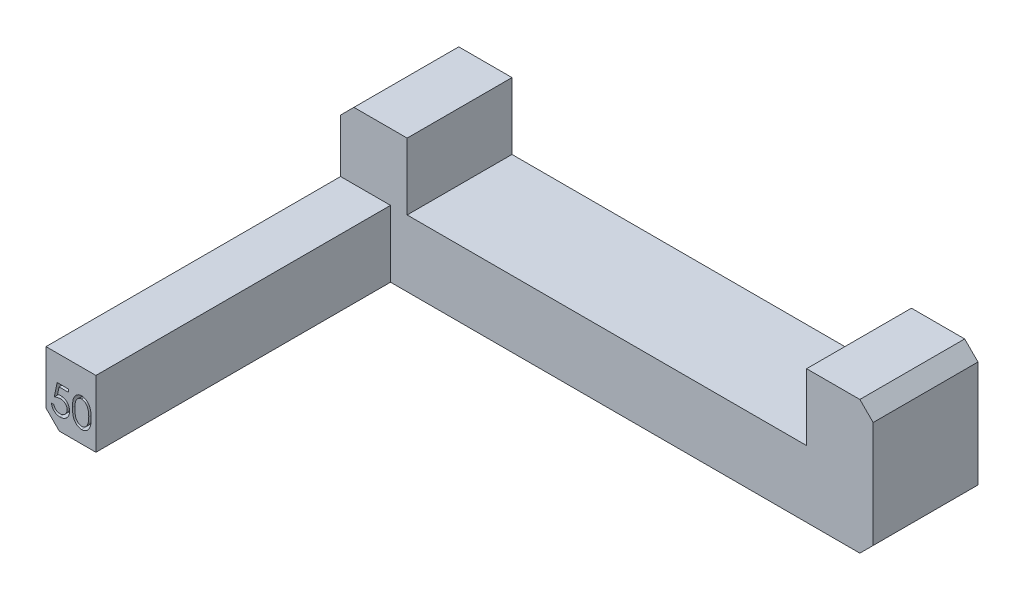
from build123d import *

# Parameters (mm, degrees)
BOSS_EXTRUDE1_DEPTH = 20
SKETCH2_W           = 9.525
SKETCH2_H           = 12.7
BOSS_EXTRUDE2_DEPTH = 56.2
CUT_EXTRUDE1_DEPTH  = 2
CHAMFER1_SIZE       = 2.54


with BuildPart() as part:
    # Sketch1 → Boss-Extrude1 (new body)
    with BuildSketch(Plane.XY):
        Polygon((-101.6, 0), (0, 0), (0, 25.4), (-12.7, 25.4), (-12.7, 12.7), (-88.9, 12.7), (-88.9, 25.4), (-101.6, 25.4), align=None)
    extrude(amount=BOSS_EXTRUDE1_DEPTH)

    # Sketch2 → Boss-Extrude2 (add)
    with BuildSketch(Plane.XY.offset(20)):
        with Locations((-96.8375, 6.35)):
            Rectangle(SKETCH2_W, SKETCH2_H)
    extrude(amount=BOSS_EXTRUDE2_DEPTH)

    # Sketch3 → Cut-Extrude1 (cut)
    # profile 1 of 2: a face of its own
    with BuildSketch(Plane.XY.offset(76.2)):
        with BuildLine():
            Line((-97.310222222, 7.831666667), (-97.310222222, 7.288931624))
            Line((-97.310222222, 7.288931624), (-99.11015211, 7.288931624))
            Line((-99.11015211, 7.288931624), (-99.395300013, 5.897113048))
            add(Edge.make_bspline(
                [(-99.395300013, 5.897113048), (-99.33927506, 5.912580244), (-99.230735575, 5.942545491), (-99.070534357, 5.975816121), (-98.918448525, 5.995872209), (-98.819758382, 5.998610738), (-98.772002738, 5.999935897)],
                knots=[0, 0, 0, 0, 1.100273476, 2.13160584, 3.095893838, 4, 4, 4, 4], degree=3))
            add(Edge.make_bspline(
                [(-98.772002738, 5.999935897), (-98.712911846, 5.998656923), (-98.596724388, 5.99614214), (-98.426727408, 5.971994225), (-98.264450296, 5.933985069), (-98.110232427, 5.880886184), (-97.963788499, 5.812986945), (-97.826465876, 5.728169178), (-97.696203317, 5.629089023), (-97.575337729, 5.51517454), (-97.465687882, 5.389804953), (-97.369279779, 5.255006743), (-97.2873911, 5.112089921), (-97.221531388, 4.959689), (-97.168940787, 4.799488852), (-97.133937176, 4.629803876), (-97.11062858, 4.452233504), (-97.108024496, 4.330820642), (-97.106696581, 4.268907919)],
                knots=[0, 0, 0, 0, 1.052922333, 2.070308379, 3.05430497, 4.020497103, 4.973039431, 5.925935799, 6.892292201, 7.88610001, 8.88166317, 9.857072816, 10.836096531, 11.812156883, 12.81219415, 13.836441305, 14.89672472, 16, 16, 16, 16], degree=3))
            add(Edge.make_bspline(
                [(-97.106696581, 4.268907919), (-97.107702112, 4.225785039), (-97.109699584, 4.140122045), (-97.119857448, 4.012904028), (-97.139415019, 3.888379268), (-97.165673364, 3.766531247), (-97.199755353, 3.647590649), (-97.241013804, 3.531217029), (-97.291505417, 3.418134707), (-97.346888567, 3.307273693), (-97.409249314, 3.201140236), (-97.478462057, 3.101885221), (-97.551586073, 3.0080197), (-97.630267692, 2.920550365), (-97.715238244, 2.840051993), (-97.80546867, 2.766046853), (-97.900238972, 2.697283413), (-98.00101535, 2.636552928), (-98.105552199, 2.580668458), (-98.215359146, 2.534822158), (-98.327936634, 2.493833621), (-98.444904958, 2.461162074), (-98.565999175, 2.435561664), (-98.691418895, 2.418173851), (-98.820506336, 2.405509475), (-98.908007843, 2.404716697), (-98.952207732, 2.404316239)],
                knots=[0, 0, 0, 0, 1.056347294, 2.098418968, 3.122841568, 4.141288669, 5.149314143, 6.15115421, 7.162517403, 8.180376062, 9.185164535, 10.17417709, 11.141909838, 12.097768115, 13.052685741, 14.0056014, 14.954263652, 15.917497458, 16.885230207, 17.854509472, 18.828990115, 19.81800267, 20.826176721, 21.857883937, 22.917946725, 24, 24, 24, 24], degree=3))
            add(Edge.make_bspline(
                [(-98.952207732, 2.404316239), (-99.004934172, 2.405360721), (-99.108667214, 2.407415614), (-99.260644738, 2.42891261), (-99.406868011, 2.459700912), (-99.546159949, 2.506020034), (-99.679768884, 2.564057968), (-99.805896088, 2.637409798), (-99.927764345, 2.720532967), (-100.040419448, 2.818625882), (-100.144976905, 2.925843639), (-100.238573651, 3.042196263), (-100.321930368, 3.165763396), (-100.3937122, 3.297145129), (-100.454941351, 3.435996241), (-100.503042583, 3.582836969), (-100.54186581, 3.73690007), (-100.558290268, 3.842965496), (-100.566632479, 3.896837607)],
                knots=[0, 0, 0, 0, 1.0467383, 2.05933395, 3.04377827, 4.011590433, 4.970194871, 5.932262533, 6.905835911, 7.896367577, 8.894135286, 9.877477877, 10.858688626, 11.851381753, 12.8477658, 13.868841284, 14.917554742, 16, 16, 16, 16], degree=3))
            Line((-100.566632479, 3.896837607), (-100.091739316, 3.896837607))
            add(Edge.make_bspline(
                [(-100.091739316, 3.896837607), (-100.080054474, 3.846375589), (-100.057595557, 3.74938479), (-100.00829877, 3.613114786), (-99.948025363, 3.491679769), (-99.876354503, 3.383473375), (-99.790856243, 3.289116915), (-99.693293892, 3.205029214), (-99.583911025, 3.129169197), (-99.462364118, 3.065937157), (-99.33413482, 3.012009398), (-99.199927252, 2.976099098), (-99.063395681, 2.950848938), (-98.971051002, 2.948321395), (-98.924646968, 2.947051282)],
                knots=[0, 0, 0, 0, 1.136247022, 2.183929868, 3.172523383, 4.106158343, 5.02341133, 5.958108904, 6.928429099, 7.938127109, 8.96079061, 9.975095812, 10.982467395, 12, 12, 12, 12], degree=3))
            add(Edge.make_bspline(
                [(-98.924646968, 2.947051282), (-98.879352654, 2.94829222), (-98.790167777, 2.950735637), (-98.658917228, 2.969542239), (-98.532200145, 2.998506662), (-98.411266879, 3.041852752), (-98.294001218, 3.094534648), (-98.183369446, 3.162139584), (-98.076171049, 3.239942231), (-97.975738037, 3.329079041), (-97.883754584, 3.427307031), (-97.802480449, 3.532350233), (-97.73478202, 3.644407847), (-97.677731641, 3.761539875), (-97.634410582, 3.885030075), (-97.603505765, 4.014299709), (-97.585358284, 4.149668072), (-97.582861857, 4.241999052), (-97.581589744, 4.289048478)],
                knots=[0, 0, 0, 0, 1.027316725, 2.022795036, 3.002884548, 3.971462791, 4.93288096, 5.914575861, 6.907176829, 7.935150275, 8.956128384, 9.956726525, 10.942570165, 11.921478529, 12.907843606, 13.90538589, 14.932640048, 16, 16, 16, 16], degree=3))
            add(Edge.make_bspline(
                [(-97.581589744, 4.289048478), (-97.582585302, 4.33149634), (-97.584533965, 4.414581991), (-97.600455185, 4.536137935), (-97.628148703, 4.651153129), (-97.666587188, 4.760182983), (-97.715390729, 4.863330331), (-97.775029797, 4.960701624), (-97.846623624, 5.051013491), (-97.928405408, 5.134308185), (-98.017997923, 5.211180793), (-98.116942629, 5.276712924), (-98.223168947, 5.331842895), (-98.335397032, 5.379419511), (-98.456296342, 5.413589686), (-98.58347268, 5.439243513), (-98.718299369, 5.454083406), (-98.810481243, 5.456142452), (-98.857865118, 5.457200855)],
                knots=[0, 0, 0, 0, 1.045622112, 2.046656509, 3.013763289, 3.955457236, 4.890082067, 5.820317437, 6.762574623, 7.722996705, 8.69280354, 9.665887285, 10.63943826, 11.638615906, 12.663482002, 13.728887084, 14.832589034, 16, 16, 16, 16], degree=3))
            add(Edge.make_bspline(
                [(-98.857865118, 5.457200855), (-98.898881474, 5.456323056), (-98.983569845, 5.454510625), (-99.113476976, 5.441165802), (-99.249989462, 5.419637345), (-99.392583996, 5.390024804), (-99.541688812, 5.351273057), (-99.696989252, 5.304835658), (-99.858811845, 5.249315493), (-99.967846976, 5.207387027), (-100.023897436, 5.185833333)],
                knots=[0, 0, 0, 0, 0.817624296, 1.688186739, 2.600797293, 3.572016777, 4.590301741, 5.671205678, 6.80286297, 8, 8, 8, 8], degree=3))
            Line((-100.023897436, 5.185833333), (-99.481162393, 7.831666667))
            Line((-99.481162393, 7.831666667), (-97.310222222, 7.831666667))
        make_face()
    # profile 2 of 2: a face of its own
    with BuildSketch(Plane.XY.offset(76.2)):
        with BuildLine():
            add(Edge.make_bspline(
                [(-96.563961538, 5.183713275), (-96.563465606, 5.268527182), (-96.562502251, 5.43327942), (-96.551785233, 5.673346677), (-96.533982037, 5.898560447), (-96.509583866, 6.108931511), (-96.479893111, 6.304514179), (-96.440257792, 6.484785776), (-96.395183673, 6.650580657), (-96.342943666, 6.802439469), (-96.283997842, 6.942408139), (-96.219841281, 7.073074812), (-96.147927842, 7.194241781), (-96.072367509, 7.307842965), (-95.990101639, 7.412018789), (-95.903471325, 7.508240433), (-95.809095393, 7.594284068), (-95.710182035, 7.672670739), (-95.605835714, 7.741386012), (-95.499030731, 7.8019117), (-95.38903194, 7.853618642), (-95.27553902, 7.89427442), (-95.159572058, 7.927855105), (-95.040725659, 7.950819348), (-94.918803597, 7.965268483), (-94.836508452, 7.966649862), (-94.794772503, 7.967350427)],
                knots=[0, 0, 0, 0, 1.646270934, 3.197905019, 4.663502075, 6.030701355, 7.308322542, 8.50163776, 9.611534131, 10.641858119, 11.616356847, 12.558055219, 13.465016945, 14.349605745, 15.204443733, 16.039544428, 16.859896111, 17.680448484, 18.487036065, 19.28249412, 20.06191084, 20.843045899, 21.620316918, 22.403196591, 23.190181807, 24, 24, 24, 24], degree=3))
            add(Edge.make_bspline(
                [(-94.794772503, 7.967350427), (-94.75268791, 7.966612897), (-94.668994897, 7.965146182), (-94.545260044, 7.951049269), (-94.424383739, 7.927658404), (-94.306881315, 7.894515978), (-94.191787586, 7.853398705), (-94.080002779, 7.801862231), (-93.970832548, 7.741871562), (-93.866011756, 7.6713807), (-93.764389659, 7.592788449), (-93.668462382, 7.50394489), (-93.578221193, 7.4057471), (-93.492533529, 7.299245711), (-93.413830423, 7.182398023), (-93.338880115, 7.057236333), (-93.271793823, 6.921571812), (-93.207183064, 6.777668009), (-93.151413453, 6.621543192), (-93.101118058, 6.454077423), (-93.060479618, 6.27329264), (-93.02662917, 6.080137365), (-93.000405339, 5.873902241), (-92.981305988, 5.655029359), (-92.971216919, 5.423374721), (-92.969316906, 5.26499083), (-92.96834188, 5.183713275)],
                knots=[0, 0, 0, 0, 0.810914788, 1.612654377, 2.396697861, 3.181598691, 3.963628158, 4.749916497, 5.551656086, 6.361998678, 7.18212741, 8.025565596, 8.878627764, 9.750805457, 10.657531673, 11.591944965, 12.560506719, 13.57287815, 14.630710178, 15.753379473, 16.941251878, 18.199788006, 19.531962791, 20.947069417, 22.433333509, 24, 24, 24, 24], degree=3))
            add(Edge.make_bspline(
                [(-92.96834188, 5.183713275), (-92.969327014, 5.102790223), (-92.971246507, 4.945114958), (-92.981192885, 4.71450265), (-93.000785101, 4.496791323), (-93.02529306, 4.291458838), (-93.059236778, 4.099359819), (-93.10097316, 3.919829522), (-93.147313529, 3.752092651), (-93.204516134, 3.597523353), (-93.267125185, 3.453965391), (-93.33524435, 3.319909107), (-93.40822373, 3.194169593), (-93.487732904, 3.077753309), (-93.572480326, 2.969835578), (-93.664279841, 2.872321315), (-93.760543701, 2.782860894), (-93.862464854, 2.703256648), (-93.968920413, 2.633580812), (-94.077715684, 2.571269396), (-94.190781038, 2.521024726), (-94.305554193, 2.477882461), (-94.423676841, 2.444922254), (-94.545001742, 2.42213202), (-94.668911765, 2.406148392), (-94.752673655, 2.404929072), (-94.794772503, 2.404316239)],
                knots=[0, 0, 0, 0, 1.561518951, 3.042555995, 4.452378317, 5.7783523, 7.031515105, 8.214008947, 9.334062868, 10.386615937, 11.391082383, 12.354592575, 13.286541444, 14.194233754, 15.072674879, 15.931287219, 16.775624067, 17.606195743, 18.42308326, 19.229000347, 20.022332153, 20.807536673, 21.593273796, 22.3848459, 23.188221202, 24, 24, 24, 24], degree=3))
            add(Edge.make_bspline(
                [(-94.794772503, 2.404316239), (-94.836507294, 2.405021324), (-94.918800156, 2.406411614), (-95.040738943, 2.42079547), (-95.159094542, 2.443920815), (-95.274450991, 2.47630068), (-95.387400127, 2.515935016), (-95.496402846, 2.567572133), (-95.60267113, 2.627041499), (-95.705921459, 2.69476791), (-95.804213654, 2.772361407), (-95.898100832, 2.858183606), (-95.985224372, 2.954376144), (-96.066314017, 3.059420147), (-96.143381984, 3.172349216), (-96.21427425, 3.294705208), (-96.279846851, 3.426002965), (-96.339784033, 3.567090758), (-96.392925465, 3.720027375), (-96.439866643, 3.886562443), (-96.476929714, 4.068165845), (-96.508653944, 4.263379007), (-96.534242, 4.473040783), (-96.551711039, 4.697264995), (-96.562508027, 4.935911918), (-96.563468193, 5.099605505), (-96.563961538, 5.183713275)],
                knots=[0, 0, 0, 0, 0.810891512, 1.598919785, 2.382837074, 3.152667961, 3.926044502, 4.706494248, 5.493654104, 6.291793342, 7.103789334, 7.925228297, 8.761435821, 9.622817696, 10.50288917, 11.416980706, 12.369136599, 13.353924996, 14.394355917, 15.514179734, 16.714354668, 17.994756427, 19.357759367, 20.818452758, 22.365282078, 24, 24, 24, 24], degree=3))
        make_face()
        with BuildLine():
            add(Edge.make_bspline(
                [(-96.089068376, 5.185833333), (-96.088887783, 5.115153753), (-96.088537289, 4.977978566), (-96.07938089, 4.778644112), (-96.066907325, 4.592724686), (-96.050818697, 4.419984221), (-96.026926144, 4.261007416), (-96.000155167, 4.114700871), (-95.967576508, 3.981838858), (-95.929030469, 3.861509668), (-95.88512612, 3.751671195), (-95.837189874, 3.649464596), (-95.785693305, 3.553682502), (-95.72806078, 3.465185261), (-95.665293958, 3.383684275), (-95.598810578, 3.307737016), (-95.526129409, 3.240008247), (-95.425582084, 3.158778359), (-95.292842176, 3.074838716), (-95.125594583, 3.001744033), (-94.953738711, 2.955808652), (-94.837093368, 2.949967021), (-94.778872062, 2.947051282)],
                knots=[0, 0, 0, 0, 1.459021318, 2.831673884, 4.118529203, 5.306027144, 6.411944654, 7.436330062, 8.375795394, 9.233974572, 10.042671642, 10.816086306, 11.563610507, 12.285937304, 12.993564865, 13.685989202, 14.367179055, 15.041617293, 16.353048772, 17.594441528, 18.799311195, 20, 20, 20, 20], degree=3))
            add(Edge.make_bspline(
                [(-94.778872062, 2.947051282), (-94.720274154, 2.949466974), (-94.60319932, 2.954293372), (-94.432151796, 3.000858129), (-94.266098888, 3.071115647), (-94.135966311, 3.154191043), (-94.036962942, 3.233306493), (-93.966028921, 3.300759592), (-93.900923205, 3.376288106), (-93.839173878, 3.457778708), (-93.782539323, 3.546788297), (-93.731039103, 3.642888858), (-93.684044042, 3.746347257), (-93.657269651, 3.818570554), (-93.643580596, 3.855496461)],
                knots=[0, 0, 0, 0, 1.353760809, 2.704726607, 4.075137775, 5.516104923, 6.260822281, 7.007110065, 7.778089737, 8.566572457, 9.372053459, 10.217411131, 11.088608312, 12, 12, 12, 12], degree=3))
            add(Edge.make_bspline(
                [(-93.643580596, 3.855496461), (-93.627627328, 3.902712853), (-93.595235352, 3.998582377), (-93.553488979, 4.147298851), (-93.520612006, 4.303331602), (-93.491034061, 4.465748147), (-93.470845512, 4.635746266), (-93.454595842, 4.812799966), (-93.445024446, 4.99704274), (-93.443837977, 5.122220881), (-93.443235043, 5.185833333)],
                knots=[0, 0, 0, 0, 0.884706709, 1.796334032, 2.740027952, 3.714592787, 4.726048262, 5.777819803, 6.87074269, 8, 8, 8, 8], degree=3))
            add(Edge.make_bspline(
                [(-93.443235043, 5.185833333), (-93.444066876, 5.249435497), (-93.445694121, 5.373854924), (-93.451914079, 5.556066935), (-93.467975911, 5.729131288), (-93.485815055, 5.893793551), (-93.512117997, 6.049142222), (-93.540478014, 6.196477803), (-93.578579847, 6.333974995), (-93.619279983, 6.463786506), (-93.665862367, 6.584437495), (-93.717139727, 6.696490482), (-93.771903577, 6.800486435), (-93.831385297, 6.896140025), (-93.894878771, 6.983879703), (-93.964059827, 7.061946292), (-94.036184296, 7.132759327), (-94.137205517, 7.21358964), (-94.269458312, 7.296006132), (-94.434022565, 7.371851984), (-94.605276991, 7.415407378), (-94.721048761, 7.421548262), (-94.778872062, 7.424615385)],
                knots=[0, 0, 0, 0, 1.31362396, 2.569729283, 3.763502607, 4.902122613, 5.988968491, 7.01645872, 7.998833611, 8.933434873, 9.825090667, 10.667526885, 11.477055099, 12.250526234, 12.991942729, 13.710640831, 14.402115721, 15.076753259, 16.378508321, 17.609869233, 18.806226677, 20, 20, 20, 20], degree=3))
            add(Edge.make_bspline(
                [(-94.778872062, 7.424615385), (-94.83739879, 7.421544031), (-94.954558869, 7.415395728), (-95.127593277, 7.372014261), (-95.293455809, 7.29639942), (-95.425358877, 7.213316666), (-95.526450555, 7.134186124), (-95.597635103, 7.065566128), (-95.664379911, 6.990505719), (-95.7258656, 6.908255205), (-95.783452969, 6.819861138), (-95.836340929, 6.724628125), (-95.883992129, 6.622073562), (-95.927965178, 6.512284428), (-95.966628798, 6.391965619), (-95.998520862, 6.259267259), (-96.02798343, 6.113426066), (-96.048840563, 5.953588238), (-96.067382193, 5.780804506), (-96.079298041, 5.594420942), (-96.088567918, 5.394752176), (-96.088898216, 5.256867734), (-96.089068376, 5.185833333)],
                knots=[0, 0, 0, 0, 1.207732386, 2.417664972, 3.655092373, 4.956220595, 5.625982001, 6.301752483, 6.994047911, 7.697131622, 8.419323945, 9.170223765, 9.943494443, 10.752040957, 11.610060368, 12.549350801, 13.567764191, 14.679664412, 15.874934091, 17.154273443, 18.533957287, 20, 20, 20, 20], degree=3))
        make_face(mode=Mode.SUBTRACT)
    extrude(amount=-CUT_EXTRUDE1_DEPTH, mode=Mode.SUBTRACT)

    # Chamfer1
    chamfer1_edges = [part.edges().sort_by_distance(p)[0] for p in [
        (0, 0, 10),
        (-101.6, 0, 38.1),
        (0, 25.4, 10),
        (-101.6, 25.4, 10),
    ]]
    chamfer(chamfer1_edges, length=CHAMFER1_SIZE)


solid = part.part
